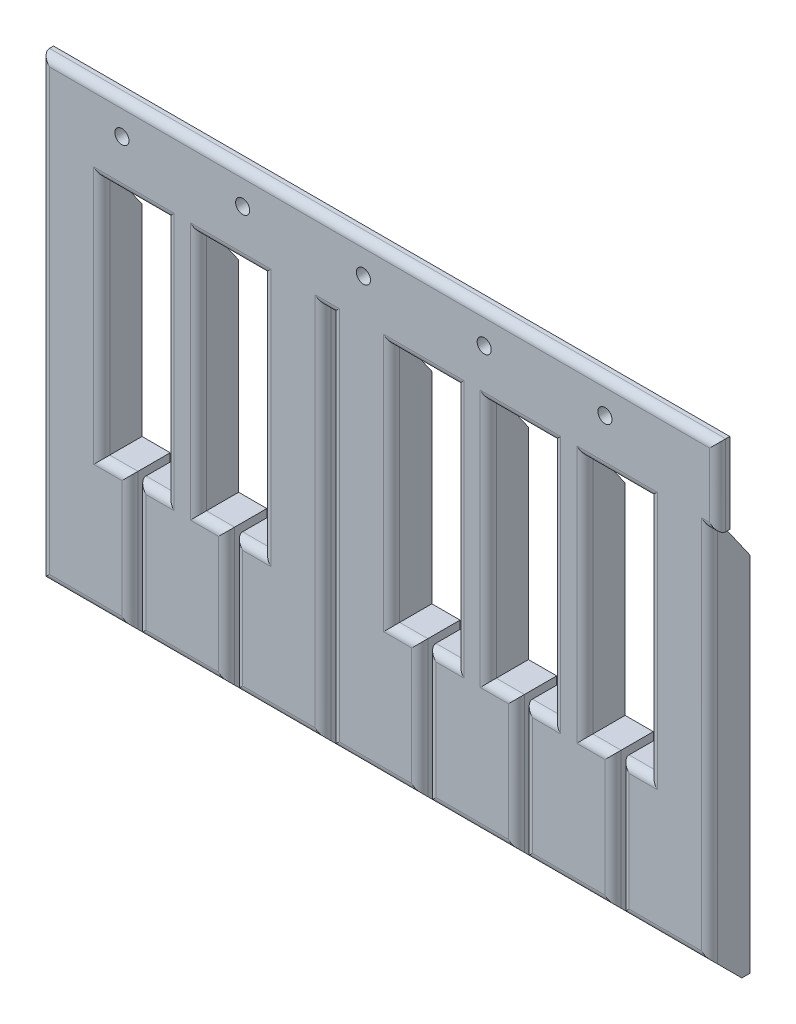
from build123d import *

# Parameters (mm, degrees)
SKETCH1_W           = 168
SKETCH1_H           = 120
BOSS_EXTRUDE1_DEPTH = 10
CHAMFER1_SIZE       = 8
SKETCH2_W           = 2
SKETCH2_H           = 100
CUT_EXTRUDE1_DEPTH  = 10
SKETCH3_W           = 168
SKETCH3_H           = 20
CUT_EXTRUDE2_DEPTH  = 7
SKETCH4_W           = 16
SKETCH4_H           = 60
CUT_EXTRUDE3_DEPTH  = 17
FILLET1_R           = 2
SHELL1_START        = -51.171572875
SHELL1_OUTLINE_W    = 11
SHELL1_OUTLINE_H    = 8
SHELL1_OUTLINE_W_2  = 4
SHELL1_DEPTH        = 89.171572875
SHELL1_2_OUTLINE_W  = 7
SHELL1_2_OUTLINE_H  = 8
SHELL1_2_DEPTH      = 29.171572875
SHELL1_START_2      = -82
SHELL1_3_DEPTH      = 18
SHELL1_START_3      = -58
SHELL1_4_DEPTH      = 18
SHELL1_START_4      = -34
SHELL1_5_DEPTH      = 18
SHELL1_START_5      = -10
SHELL1_6_DEPTH      = 18
SHELL1_START_6      = 14
SHELL1_7_DEPTH      = 18
SHELL1_START_7      = 38
SHELL1_8_DEPTH      = 18
SHELL1_START_8      = 62
SHELL1_9_DEPTH      = 18
SKETCH5_R           = 1.75
CUT_EXTRUDE4_DEPTH  = 7
CUT_EXTRUDE5_DEPTH  = 179.672885464


with BuildPart() as part:
    # Sketch1 → Boss-Extrude1 (new body)
    with BuildSketch(Plane.XY):
        Rectangle(SKETCH1_W, SKETCH1_H)
    extrude(amount=BOSS_EXTRUDE1_DEPTH)

    # Chamfer1
    chamfer1_edges = [part.edges().sort_by_distance(p)[0] for p in [
        (0, -60, 10),
    ]]
    chamfer(chamfer1_edges, length=CHAMFER1_SIZE)

    # Sketch2 → Cut-Extrude1 (cut)
    with BuildSketch(Plane.XY.offset(10)):
        with Locations((-61, -10)):
            Rectangle(SKETCH2_W, SKETCH2_H)
        with Locations((-37, -10)):
            Rectangle(SKETCH2_W, SKETCH2_H)
        with Locations((-13, -10)):
            Rectangle(SKETCH2_W, SKETCH2_H)
        with Locations((11, -10)):
            Rectangle(SKETCH2_W, SKETCH2_H)
        with Locations((35, -10)):
            Rectangle(SKETCH2_W, SKETCH2_H)
        with Locations((59, -10)):
            Rectangle(SKETCH2_W, SKETCH2_H)
        with Locations((83, -10)):
            Rectangle(SKETCH2_W, SKETCH2_H)
    extrude(amount=-CUT_EXTRUDE1_DEPTH, mode=Mode.SUBTRACT)

    # Sketch3 → Cut-Extrude2 (cut)
    with BuildSketch(Plane(origin=(0, 0, 0), x_dir=(-1, 0, 0), z_dir=(0, 0, -1))):
        with Locations((0, 50)):
            Rectangle(SKETCH3_W, SKETCH3_H)
    extrude(amount=-CUT_EXTRUDE2_DEPTH, mode=Mode.SUBTRACT)

    # Sketch4 → Cut-Extrude3 (cut)
    with BuildSketch(Plane.XY.offset(10)):
        with Locations((-61, 10)):
            Rectangle(SKETCH4_W, SKETCH4_H)
        with Locations((-37, 10)):
            Rectangle(SKETCH4_W, SKETCH4_H)
        with Locations((11, 10)):
            Rectangle(SKETCH4_W, SKETCH4_H)
        with Locations((35, 10)):
            Rectangle(SKETCH4_W, SKETCH4_H)
        with Locations((59, 10)):
            Rectangle(SKETCH4_W, SKETCH4_H)
    extrude(amount=-CUT_EXTRUDE3_DEPTH, mode=Mode.SUBTRACT)

    # Fillet1
    fillet1_edges = [part.edges().sort_by_distance(p)[0] for p in [
        (-65.5, -20, 10),
        (-62, -36, 10),
        (-73, -52, 10),
        (-84, 4, 10),
        (0, 60, 10),
        (84, 50, 10),
        (83, 40, 10),
        (82, -6, 10),
        (71, -52, 10),
        (60, -36, 10),
        (63.5, -20, 10),
        (67, 10, 10),
        (59, 40, 10),
        (51, 10, 10),
        (54.5, -20, 10),
        (58, -36, 10),
        (47, -52, 10),
        (36, -36, 10),
        (39.5, -20, 10),
        (43, 10, 10),
        (35, 40, 10),
        (27, 10, 10),
        (30.5, -20, 10),
        (34, -36, 10),
        (23, -52, 10),
        (12, -36, 10),
        (15.5, -20, 10),
        (19, 10, 10),
        (11, 40, 10),
        (3, 10, 10),
        (6.5, -20, 10),
        (10, -36, 10),
        (-1, -52, 10),
        (-12, -6, 10),
        (-13, 40, 10),
        (-14, -6, 10),
        (-25, -52, 10),
        (-36, -36, 10),
        (-32.5, -20, 10),
        (-29, 10, 10),
        (-37, 40, 10),
        (-45, 10, 10),
        (-41.5, -20, 10),
        (-38, -36, 10),
        (-49, -52, 10),
        (-60, -36, 10),
        (-56.5, -20, 10),
        (-53, 10, 10),
        (-61, 40, 10),
        (-69, 10, 10),
    ]]
    fillet(fillet1_edges, radius=FILLET1_R)

    # Shell1: read off the stored shape, not the designer's step
    # Shell1 outline → Shell1 (cut)
    with BuildSketch(Plane(origin=(0, 0, 0), x_dir=(1, 0, 0), z_dir=(0, 1, 0)).offset(SHELL1_START)):
        with Locations((74.5, -4)):
            Rectangle(SHELL1_OUTLINE_W, SHELL1_OUTLINE_H)
        with Locations((47, -4)):
            Rectangle(SHELL1_OUTLINE_W_2, SHELL1_OUTLINE_H)
        with Locations((23, -4)):
            Rectangle(SHELL1_OUTLINE_W_2, SHELL1_OUTLINE_H)
        with Locations((-4.5, -4)):
            Rectangle(SHELL1_OUTLINE_W, SHELL1_OUTLINE_H)
        with Locations((-21.5, -4)):
            Rectangle(SHELL1_OUTLINE_W, SHELL1_OUTLINE_H)
        with Locations((-49, -4)):
            Rectangle(SHELL1_OUTLINE_W_2, SHELL1_OUTLINE_H)
        with Locations((-76.5, -4)):
            Rectangle(SHELL1_OUTLINE_W, SHELL1_OUTLINE_H)
    extrude(amount=SHELL1_DEPTH, mode=Mode.SUBTRACT)

    # Shell1 2 outline → Shell1 2 (cut)
    with BuildSketch(Plane(origin=(0, 0, 0), x_dir=(1, 0, 0), z_dir=(0, 1, 0)).offset(SHELL1_START)):
        with Locations((65.5, -4)):
            Rectangle(SHELL1_2_OUTLINE_W, SHELL1_2_OUTLINE_H)
        with Locations((41.5, -4)):
            Rectangle(SHELL1_2_OUTLINE_W, SHELL1_2_OUTLINE_H)
        with Locations((52.5, -4)):
            Rectangle(SHELL1_2_OUTLINE_W, SHELL1_2_OUTLINE_H)
        with Locations((17.5, -4)):
            Rectangle(SHELL1_2_OUTLINE_W, SHELL1_2_OUTLINE_H)
        with Locations((28.5, -4)):
            Rectangle(SHELL1_2_OUTLINE_W, SHELL1_2_OUTLINE_H)
        with Locations((4.5, -4)):
            Rectangle(SHELL1_2_OUTLINE_W, SHELL1_2_OUTLINE_H)
        with Locations((-30.5, -4)):
            Rectangle(SHELL1_2_OUTLINE_W, SHELL1_2_OUTLINE_H)
        with Locations((-54.5, -4)):
            Rectangle(SHELL1_2_OUTLINE_W, SHELL1_2_OUTLINE_H)
        with Locations((-43.5, -4)):
            Rectangle(SHELL1_2_OUTLINE_W, SHELL1_2_OUTLINE_H)
        with Locations((-67.5, -4)):
            Rectangle(SHELL1_2_OUTLINE_W, SHELL1_2_OUTLINE_H)
    extrude(amount=SHELL1_2_DEPTH, mode=Mode.SUBTRACT)

    # Shell1 3 outline → Shell1 3 (cut)
    with BuildSketch(Plane.YZ.offset(SHELL1_START_2)):
        Polygon((-51.171572875, 0), (-51.171572875, 8), (-58, 1.171572875), (-58, 0), align=None)
    extrude(amount=SHELL1_3_DEPTH, mode=Mode.SUBTRACT)

    # Shell1 4 outline → Shell1 4 (cut)
    with BuildSketch(Plane.YZ.offset(SHELL1_START_3)):
        Polygon((-51.171572875, 0), (-51.171572875, 8), (-58, 1.171572875), (-58, 0), align=None)
    extrude(amount=SHELL1_4_DEPTH, mode=Mode.SUBTRACT)

    # Shell1 5 outline → Shell1 5 (cut)
    with BuildSketch(Plane.YZ.offset(SHELL1_START_4)):
        Polygon((-51.171572875, 0), (-51.171572875, 8), (-58, 1.171572875), (-58, 0), align=None)
    extrude(amount=SHELL1_5_DEPTH, mode=Mode.SUBTRACT)

    # Shell1 6 outline → Shell1 6 (cut)
    with BuildSketch(Plane.YZ.offset(SHELL1_START_5)):
        Polygon((-51.171572875, 0), (-51.171572875, 8), (-58, 1.171572875), (-58, 0), align=None)
    extrude(amount=SHELL1_6_DEPTH, mode=Mode.SUBTRACT)

    # Shell1 7 outline → Shell1 7 (cut)
    with BuildSketch(Plane.YZ.offset(SHELL1_START_6)):
        Polygon((-51.171572875, 0), (-51.171572875, 8), (-58, 1.171572875), (-58, 0), align=None)
    extrude(amount=SHELL1_7_DEPTH, mode=Mode.SUBTRACT)

    # Shell1 8 outline → Shell1 8 (cut)
    with BuildSketch(Plane.YZ.offset(SHELL1_START_7)):
        Polygon((-51.171572875, 0), (-51.171572875, 8), (-58, 1.171572875), (-58, 0), align=None)
    extrude(amount=SHELL1_8_DEPTH, mode=Mode.SUBTRACT)

    # Shell1 9 outline → Shell1 9 (cut)
    with BuildSketch(Plane.YZ.offset(SHELL1_START_8)):
        Polygon((-51.171572875, 0), (-51.171572875, 8), (-58, 1.171572875), (-58, 0), align=None)
    extrude(amount=SHELL1_9_DEPTH, mode=Mode.SUBTRACT)

    # Sketch5 → Cut-Extrude4 (cut)
    with BuildSketch(Plane.XY.offset(10)):
        with Locations((-64, 52)):
            Circle(SKETCH5_R)
        with Locations((-34, 52)):
            Circle(SKETCH5_R)
        with Locations((-4, 52)):
            Circle(SKETCH5_R)
        with Locations((26, 52)):
            Circle(SKETCH5_R)
        with Locations((56, 52)):
            Circle(SKETCH5_R)
    extrude(amount=-CUT_EXTRUDE4_DEPTH, mode=Mode.SUBTRACT)

    # Sketch6 → Cut-Extrude5 (cut, through all)
    with BuildSketch(Plane.ZY.offset(84)):
        Polygon((7, 40), (0, 30), (0, 40), align=None)
    extrude(amount=-CUT_EXTRUDE5_DEPTH, mode=Mode.SUBTRACT)


solid = part.part
